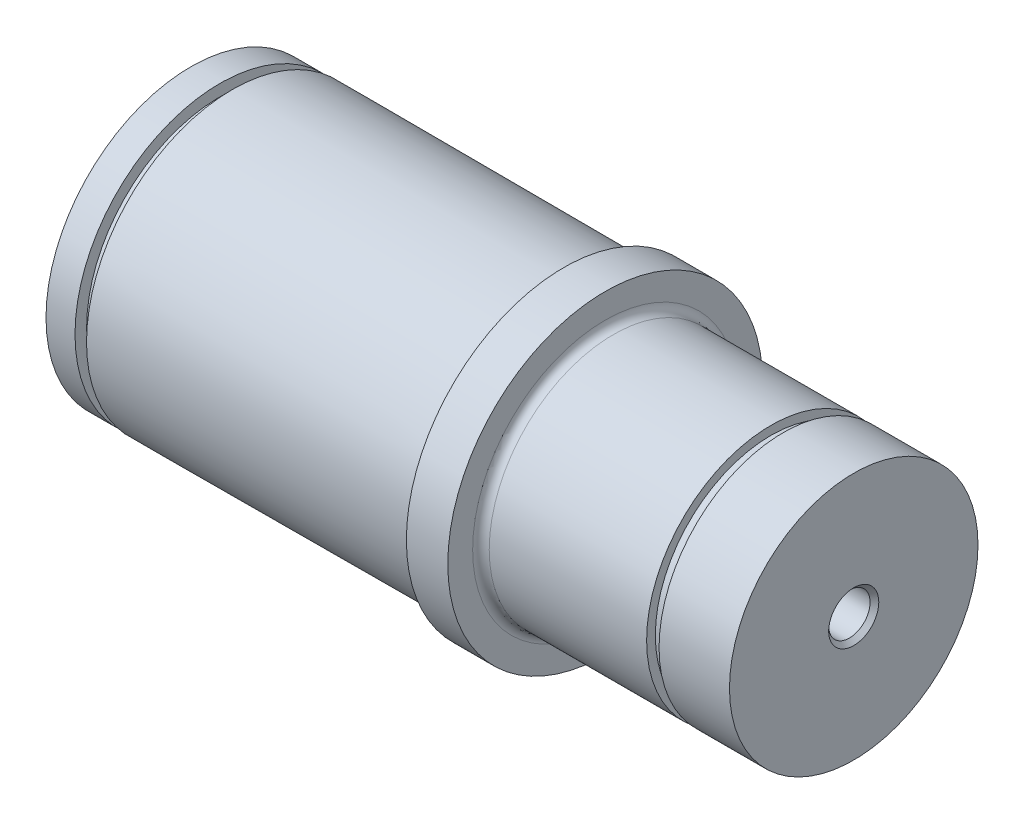
from build123d import *

# Parameters (mm, degrees)
FILLET1_R                   = 1
M6_TAPPED_HOLE1_D           = 5
M6_TAPPED_HOLE1_CSINK_D     = 6.05
M6_TAPPED_HOLE1_CSINK_ANGLE = 90


# Read off the part's stored shape, not the designer's step: Revolve1
with BuildPart() as part:
    # Revolve1 outline → Revolve1 (revolve)
    with BuildSketch(Plane.YX):
        Polygon((0, 80), (0, 0), (17.5, 0), (17.5, 3.5), (16.1, 3.5), (16.1, 5), (17.61, 5), (17.5, 45), (19, 45), (19, 50), (15, 50), (15, 70), (13.95, 70), (13.95, 71.5), (15, 71.5), (15, 80), align=None)
    revolve(axis=Axis((0, 0, 0), (1, 0, 0)))

    # Fillet1
    fillet1_edges = [part.edges().sort_by_distance(p)[0] for p in [
        (50, -15, 0),
    ]]
    fillet(fillet1_edges, radius=FILLET1_R)

    # M6 Tapped Hole1 (through all)
    with Locations(Plane(origin=(80, 0, 0), x_dir=(0, 0, 1), z_dir=(1, 0, 0))):
        with Locations((0, 0)):
            CounterSinkHole(M6_TAPPED_HOLE1_D / 2, M6_TAPPED_HOLE1_CSINK_D / 2, counter_sink_angle=M6_TAPPED_HOLE1_CSINK_ANGLE)


solid = part.part
